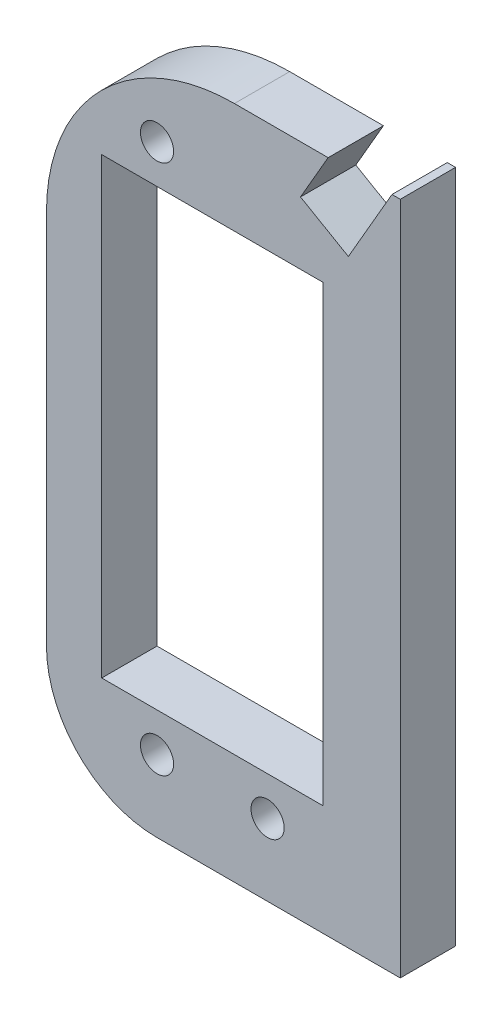
from build123d import *

# Parameters (mm, degrees)
ESQUISSE1_R        = 1.5
BOSS_EXTRU_1_DEPTH = 5
CONG_1_R           = 17
CONG_2_R           = 10


with BuildPart() as part:
    # Esquisse1 → Boss.-Extru.1 (new body)
    with BuildSketch(Plane.XY):
        Polygon((0, 0), (25, 0), (32, 0), (32, 61), (31.250785563, 61), (27.30740989, 54.169872981), (22.977282871, 56.669872981), (25.477282871, 61), (15, 61), (0, 61), align=None)
        with Locations((10, 54.5)):
            Circle(ESQUISSE1_R, mode=Mode.SUBTRACT)
        with Locations((20, 6.5)):
            Circle(ESQUISSE1_R, mode=Mode.SUBTRACT)
        with Locations((10, 6.5)):
            Circle(ESQUISSE1_R, mode=Mode.SUBTRACT)
        Polygon((15, 51), (5, 51), (5, 10), (25, 10), (25, 51), align=None, mode=Mode.SUBTRACT)
    extrude(amount=BOSS_EXTRU_1_DEPTH)

    # Congé1
    cong_1_edges = [part.edges().sort_by_distance(p)[0] for p in [
        (0, 61, 2.5),
    ]]
    fillet(cong_1_edges, radius=CONG_1_R)

    # Congé2
    cong_2_edges = [part.edges().sort_by_distance(p)[0] for p in [
        (0, 0, 2.5),
    ]]
    fillet(cong_2_edges, radius=CONG_2_R)


solid = part.part
